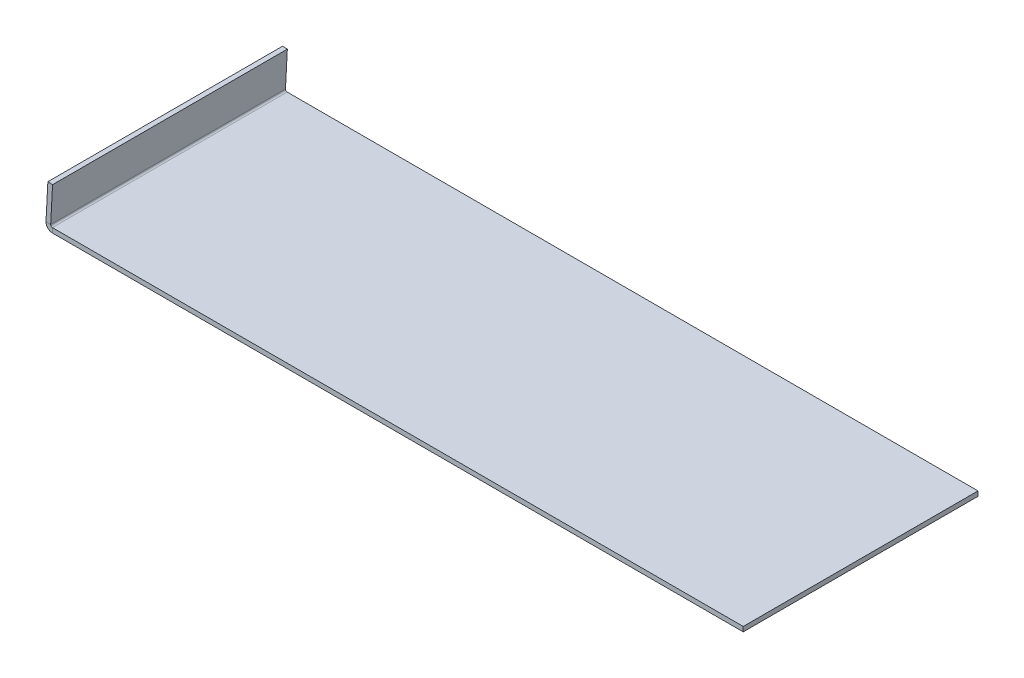
from build123d import *

# Parameters (mm, degrees)
SKETCH1_W            = 297
SKETCH1_H            = 100
BASE_FLANGE1_DEPTH   = 2
EDGE_FLANGE1_START   = -50
EDGE_FLANGE1_DEPTH   = 100
EDGE_FLANGE1_2_DEPTH = 100


# Read off the part's stored shape, not the designer's step: Edge-Flange1
# Sheet-metal steps are written as plain solids
with BuildPart() as part:
    # Sketch1 → Base-Flange1 (new body)
    with BuildSketch(Plane(origin=(0, 0, 0), x_dir=(1, 0, 0), z_dir=(0, 1, 0))):
        Rectangle(SKETCH1_W, SKETCH1_H)
    extrude(amount=-BASE_FLANGE1_DEPTH)

    # Edge-Flange1 outline → Edge-Flange1 (cut)
    with BuildSketch(Plane.XY.offset(EDGE_FLANGE1_START)):
        with BuildLine():
            ThreePointArc((-145.721040868, -2), (-147.375308077, -1.443395312), (-148.356643266, 0))
            Line((-148.356643266, 0), (-148.5, 0))
            Line((-148.5, 0), (-148.5, -2))
            Line((-148.5, -2), (-145.721040868, -2))
        make_face()
    extrude(amount=EDGE_FLANGE1_DEPTH, mode=Mode.SUBTRACT)

    # Edge-Flange1 2 outline → Edge-Flange1 2 (add)
    with BuildSketch(Plane.XY.offset(EDGE_FLANGE1_START)):
        with BuildLine():
            Line((-147.662768346, 15.975331626), (-148.453890453, 0.879822578))
            ThreePointArc((-148.453890453, 0.879822578), (-148.441075999, 0.435953289), (-148.356643266, 0))
            Line((-148.356643266, 0), (-145.721040868, 0))
            ThreePointArc((-145.721040868, 0), (-146.255351629, 0.22955802), (-146.456631383, 0.775150665))
            Line((-146.456631383, 0.775150665), (-145.665509277, 15.870659713))
            Line((-145.665509277, 15.870659713), (-147.662768346, 15.975331626))
        make_face()
    extrude(amount=EDGE_FLANGE1_2_DEPTH)


solid = part.part
